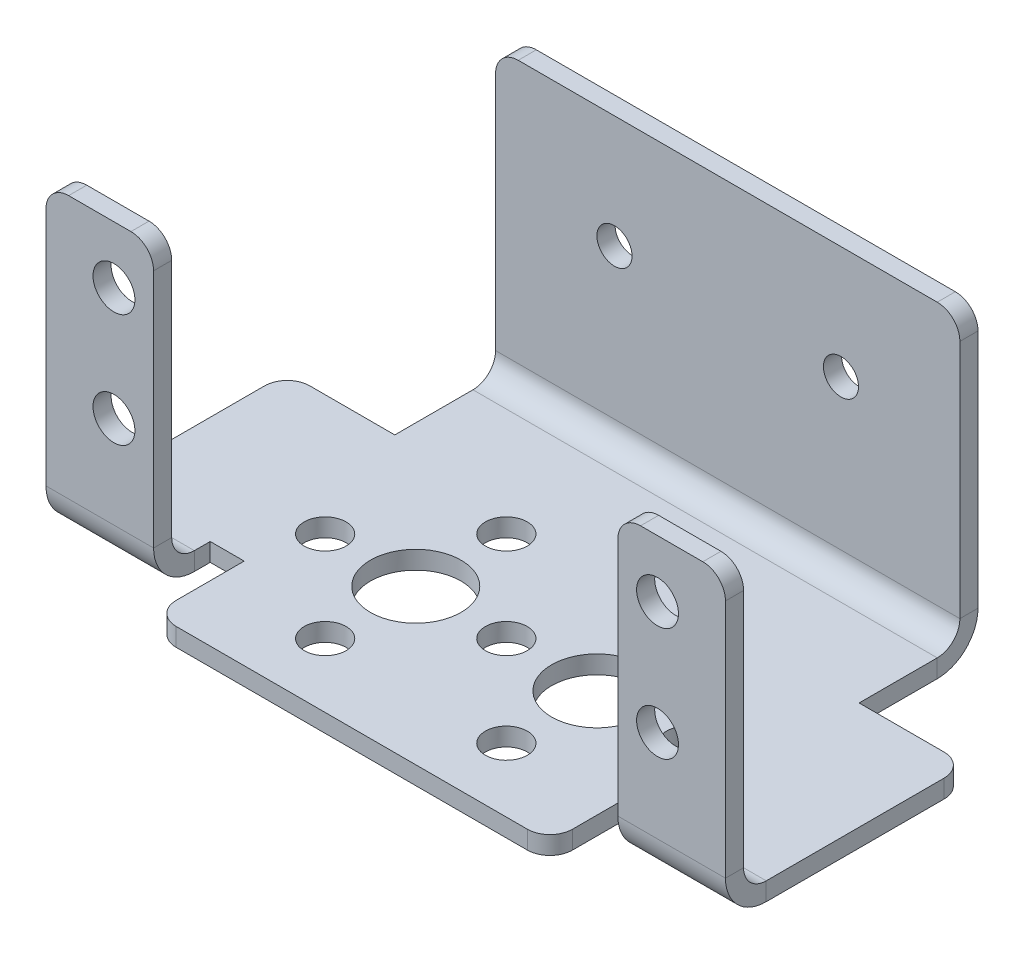
from build123d import *

# Parameters (mm, degrees)
BASE_FLANGE1_DEPTH             = 1.6
EDGE_FLANGE1_STRIP_W           = 10.4
EDGE_FLANGE1_STRIP_H           = 1.6
EDGE_FLANGE1_STRIP_CUT_DEPTH   = 41
EDGE_FLANGE1_STRIP_2_W         = 10.4
EDGE_FLANGE1_STRIP_2_H         = 1.6
EDGE_FLANGE1_STRIP_CUT_2_DEPTH = 9.5
EDGE_FLANGE1_STRIP_3_W         = 10.4
EDGE_FLANGE1_STRIP_3_H         = 1.6
EDGE_FLANGE1_STRIP_CUT_3_DEPTH = 9.5
EDGE_FLANGE1_DEPTH             = 41
EDGE_FLANGE1_BEND_DEPTH        = 9.5
EDGE_FLANGE1_BEND_2_DEPTH      = 9.5
CUT_EXTRUDE1_REACH             = 46.524
SKETCH15_R                     = 1.85
SKETCH15_R_2                   = 4
CUT_EXTRUDE2_REACH             = 53.278
SKETCH16_R                     = 1.85
CUT_EXTRUDE3_REACH             = 54.158
SKETCH17_R                     = 1.55
FILLET1_R                      = 2


# Sheet-metal steps are written as plain solids
with BuildPart() as part:
    # Sketch1 → Base-Flange1 (new body)
    with BuildSketch(Plane(origin=(0, 0, 0), x_dir=(1, 0, 0), z_dir=(0, 1, 0))):
        Polygon((-20.5, 21.15), (20.5, 21.15), (20.5, 10.65), (30, 10.65), (30, -10.65), (20.5, -10.65), (20.5, -5.65), (17.5, -5.65), (17.5, -13.65), (-17.5, -13.65), (-17.5, -5.65), (-20.5, -5.65), (-20.5, -10.65), (-30, -10.65), (-30, 10.65), (-20.5, 10.65), align=None)
    extrude(amount=BASE_FLANGE1_DEPTH)

    # Edge-Flange1 strip (across the edge) → Edge-Flange1 strip cut (cut)
    with BuildSketch(Plane(origin=(20.5, 1.6, -21.15), x_dir=(0, 0, 1), z_dir=(-1, 0, 0))):
        with Locations((-1.6, -0.8)):
            Rectangle(EDGE_FLANGE1_STRIP_W, EDGE_FLANGE1_STRIP_H)
    extrude(amount=EDGE_FLANGE1_STRIP_CUT_DEPTH, mode=Mode.SUBTRACT)

    # Edge-Flange1 strip 2 (across the edge) → Edge-Flange1 strip cut 2 (cut)
    with BuildSketch(Plane(origin=(20.5, 1.6, 10.65), x_dir=(0, 0, -1), z_dir=(1, 0, 0))):
        with Locations((-1.6, -0.8)):
            Rectangle(EDGE_FLANGE1_STRIP_2_W, EDGE_FLANGE1_STRIP_2_H)
    extrude(amount=EDGE_FLANGE1_STRIP_CUT_2_DEPTH, mode=Mode.SUBTRACT)

    # Edge-Flange1 strip 3 (across the edge) → Edge-Flange1 strip cut 3 (cut)
    with BuildSketch(Plane(origin=(-30, 1.6, 10.65), x_dir=(0, 0, -1), z_dir=(1, 0, 0))):
        with Locations((-1.6, -0.8)):
            Rectangle(EDGE_FLANGE1_STRIP_3_W, EDGE_FLANGE1_STRIP_3_H)
    extrude(amount=EDGE_FLANGE1_STRIP_CUT_3_DEPTH, mode=Mode.SUBTRACT)

    # Edge-Flange1 section (across the edge) → Edge-Flange1 (add)
    with BuildSketch(Plane(origin=(20.5, 1.6, -21.15), x_dir=(0, 0, 1), z_dir=(-1, 0, 0))):
        with BuildLine():
            Line((0, 2), (0, 25.2))
            Line((0, 25.2), (1.6, 25.2))
            Line((1.6, 25.2), (1.6, 2))
            ThreePointArc((1.6, 2), (2.185786438, 0.585786438), (3.6, 0))
            Line((3.6, 0), (3.6, -1.6))
            ThreePointArc((3.6, -1.6), (1.054415588, -0.545584412), (0, 2))
        make_face()
    extrude(amount=EDGE_FLANGE1_DEPTH)

    # Edge-Flange1 section 2 (across the edge) → Edge-Flange1 bend (add)
    with BuildSketch(Plane(origin=(20.5, 1.6, 10.65), x_dir=(0, 0, -1), z_dir=(1, 0, 0))):
        with BuildLine():
            Line((0, 2), (0, 25.2))
            Line((0, 25.2), (1.6, 25.2))
            Line((1.6, 25.2), (1.6, 2))
            ThreePointArc((1.6, 2), (2.185786438, 0.585786438), (3.6, 0))
            Line((3.6, 0), (3.6, -1.6))
            ThreePointArc((3.6, -1.6), (1.054415588, -0.545584412), (0, 2))
        make_face()
    extrude(amount=EDGE_FLANGE1_BEND_DEPTH)

    # Edge-Flange1 section 3 (across the edge) → Edge-Flange1 bend 2 (add)
    with BuildSketch(Plane(origin=(-30, 1.6, 10.65), x_dir=(0, 0, -1), z_dir=(1, 0, 0))):
        with BuildLine():
            Line((0, 2), (0, 25.2))
            Line((0, 25.2), (1.6, 25.2))
            Line((1.6, 25.2), (1.6, 2))
            ThreePointArc((1.6, 2), (2.185786438, 0.585786438), (3.6, 0))
            Line((3.6, 0), (3.6, -1.6))
            ThreePointArc((3.6, -1.6), (1.054415588, -0.545584412), (0, 2))
        make_face()
    extrude(amount=EDGE_FLANGE1_BEND_2_DEPTH)

    # Sketch15 → Cut-Extrude1 (cut, up to next)
    with BuildSketch(Plane(origin=(0, 1.6, 0), x_dir=(1, 0, 0), z_dir=(0, 1, 0)), mode=Mode.PRIVATE) as cut_extrude1_sk1:
        with Locations(Location((0, 0, 0), (0, 0, 270))):
            Circle(SKETCH15_R)
    cut_extrude1_tool1 = extrude(cut_extrude1_sk1.sketch, amount=-CUT_EXTRUDE1_REACH, mode=Mode.PRIVATE) & part.part
    # Sketch15 → Cut-Extrude1 (cut, up to next)
    with BuildSketch(Plane(origin=(0, 1.6, 0), x_dir=(1, 0, 0), z_dir=(0, 1, 0)), mode=Mode.PRIVATE) as cut_extrude1_sk2:
        with Locations(Location((8, 0, 0), (0, 0, 270))):
            Circle(SKETCH15_R_2)
    cut_extrude1_tool2 = extrude(cut_extrude1_sk2.sketch, amount=-CUT_EXTRUDE1_REACH, mode=Mode.PRIVATE) & part.part
    # Sketch15 → Cut-Extrude1 (cut, up to next)
    with BuildSketch(Plane(origin=(0, 1.6, 0), x_dir=(1, 0, 0), z_dir=(0, 1, 0)), mode=Mode.PRIVATE) as cut_extrude1_sk3:
        with Locations(Location((-8, 0, 0), (0, 0, 270))):
            Circle(SKETCH15_R_2)
    cut_extrude1_tool3 = extrude(cut_extrude1_sk3.sketch, amount=-CUT_EXTRUDE1_REACH, mode=Mode.PRIVATE) & part.part
    # Sketch15 → Cut-Extrude1 (cut, up to next)
    with BuildSketch(Plane(origin=(0, 1.6, 0), x_dir=(1, 0, 0), z_dir=(0, 1, 0)), mode=Mode.PRIVATE) as cut_extrude1_sk4:
        with Locations(Location((16, 0, 0), (0, 0, 270))):
            Circle(SKETCH15_R)
    cut_extrude1_tool4 = extrude(cut_extrude1_sk4.sketch, amount=-CUT_EXTRUDE1_REACH, mode=Mode.PRIVATE) & part.part
    # Sketch15 → Cut-Extrude1 (cut, up to next)
    with BuildSketch(Plane(origin=(0, 1.6, 0), x_dir=(1, 0, 0), z_dir=(0, 1, 0)), mode=Mode.PRIVATE) as cut_extrude1_sk5:
        with Locations(Location((-16, 0, 0), (0, 0, 270))):
            Circle(SKETCH15_R)
    cut_extrude1_tool5 = extrude(cut_extrude1_sk5.sketch, amount=-CUT_EXTRUDE1_REACH, mode=Mode.PRIVATE) & part.part
    # Sketch15 → Cut-Extrude1 (cut, up to next)
    with BuildSketch(Plane(origin=(0, 1.6, 0), x_dir=(1, 0, 0), z_dir=(0, 1, 0)), mode=Mode.PRIVATE) as cut_extrude1_sk6:
        with Locations(Location((-8, 8, 0), (0, 0, 270))):
            Circle(SKETCH15_R)
    cut_extrude1_tool6 = extrude(cut_extrude1_sk6.sketch, amount=-CUT_EXTRUDE1_REACH, mode=Mode.PRIVATE) & part.part
    # Sketch15 → Cut-Extrude1 (cut, up to next)
    with BuildSketch(Plane(origin=(0, 1.6, 0), x_dir=(1, 0, 0), z_dir=(0, 1, 0)), mode=Mode.PRIVATE) as cut_extrude1_sk7:
        with Locations(Location((-8, -8, 0), (0, 0, 270))):
            Circle(SKETCH15_R)
    cut_extrude1_tool7 = extrude(cut_extrude1_sk7.sketch, amount=-CUT_EXTRUDE1_REACH, mode=Mode.PRIVATE) & part.part
    # Sketch15 → Cut-Extrude1 (cut, up to next)
    with BuildSketch(Plane(origin=(0, 1.6, 0), x_dir=(1, 0, 0), z_dir=(0, 1, 0)), mode=Mode.PRIVATE) as cut_extrude1_sk8:
        with Locations(Location((8, -8, 0), (0, 0, 270))):
            Circle(SKETCH15_R)
    cut_extrude1_tool8 = extrude(cut_extrude1_sk8.sketch, amount=-CUT_EXTRUDE1_REACH, mode=Mode.PRIVATE) & part.part
    # Sketch15 → Cut-Extrude1 (cut, up to next)
    with BuildSketch(Plane(origin=(0, 1.6, 0), x_dir=(1, 0, 0), z_dir=(0, 1, 0)), mode=Mode.PRIVATE) as cut_extrude1_sk9:
        with Locations(Location((8, 8, 0), (0, 0, 270))):
            Circle(SKETCH15_R)
    cut_extrude1_tool9 = extrude(cut_extrude1_sk9.sketch, amount=-CUT_EXTRUDE1_REACH, mode=Mode.PRIVATE) & part.part
    add(cut_extrude1_tool1.solids().sort_by_distance((0, 1.6, 0))[0], mode=Mode.SUBTRACT)
    add(cut_extrude1_tool2.solids().sort_by_distance((8, 1.6, 0))[0], mode=Mode.SUBTRACT)
    add(cut_extrude1_tool3.solids().sort_by_distance((-8, 1.6, 0))[0], mode=Mode.SUBTRACT)
    add(cut_extrude1_tool4.solids().sort_by_distance((16, 1.6, 0))[0], mode=Mode.SUBTRACT)
    add(cut_extrude1_tool5.solids().sort_by_distance((-16, 1.6, 0))[0], mode=Mode.SUBTRACT)
    add(cut_extrude1_tool6.solids().sort_by_distance((-8, 1.6, -8))[0], mode=Mode.SUBTRACT)
    add(cut_extrude1_tool7.solids().sort_by_distance((-8, 1.6, 8))[0], mode=Mode.SUBTRACT)
    add(cut_extrude1_tool8.solids().sort_by_distance((8, 1.6, 8))[0], mode=Mode.SUBTRACT)
    add(cut_extrude1_tool9.solids().sort_by_distance((8, 1.6, -8))[0], mode=Mode.SUBTRACT)

    # Sketch16 → Cut-Extrude2 (cut, up to next)
    with BuildSketch(Plane.XY.offset(10.65), mode=Mode.PRIVATE) as cut_extrude2_sk1:
        with Locations((-24, 21.75)):
            Circle(SKETCH16_R)
    cut_extrude2_tool1 = extrude(cut_extrude2_sk1.sketch, amount=-CUT_EXTRUDE2_REACH, mode=Mode.PRIVATE) & part.part
    # Sketch16 → Cut-Extrude2 (cut, up to next)
    with BuildSketch(Plane.XY.offset(10.65), mode=Mode.PRIVATE) as cut_extrude2_sk2:
        with Locations((-24, 11.75)):
            Circle(SKETCH16_R)
    cut_extrude2_tool2 = extrude(cut_extrude2_sk2.sketch, amount=-CUT_EXTRUDE2_REACH, mode=Mode.PRIVATE) & part.part
    # Sketch16 → Cut-Extrude2 (cut, up to next)
    with BuildSketch(Plane.XY.offset(10.65), mode=Mode.PRIVATE) as cut_extrude2_sk3:
        with Locations((24, 21.75)):
            Circle(SKETCH16_R)
    cut_extrude2_tool3 = extrude(cut_extrude2_sk3.sketch, amount=-CUT_EXTRUDE2_REACH, mode=Mode.PRIVATE) & part.part
    # Sketch16 → Cut-Extrude2 (cut, up to next)
    with BuildSketch(Plane.XY.offset(10.65), mode=Mode.PRIVATE) as cut_extrude2_sk4:
        with Locations((24, 11.75)):
            Circle(SKETCH16_R)
    cut_extrude2_tool4 = extrude(cut_extrude2_sk4.sketch, amount=-CUT_EXTRUDE2_REACH, mode=Mode.PRIVATE) & part.part
    add(cut_extrude2_tool1.solids().sort_by_distance((-24, 21.75, 10.65))[0], mode=Mode.SUBTRACT)
    add(cut_extrude2_tool2.solids().sort_by_distance((-24, 11.75, 10.65))[0], mode=Mode.SUBTRACT)
    add(cut_extrude2_tool3.solids().sort_by_distance((24, 21.75, 10.65))[0], mode=Mode.SUBTRACT)
    add(cut_extrude2_tool4.solids().sort_by_distance((24, 11.75, 10.65))[0], mode=Mode.SUBTRACT)

    # Sketch17 → Cut-Extrude3 (cut, up to next)
    with BuildSketch(Plane.XY.offset(-19.55), mode=Mode.PRIVATE) as cut_extrude3_sk1:
        with Locations((-10, 16.85)):
            Circle(SKETCH17_R)
    cut_extrude3_tool1 = extrude(cut_extrude3_sk1.sketch, amount=-CUT_EXTRUDE3_REACH, mode=Mode.PRIVATE) & part.part
    # Sketch17 → Cut-Extrude3 (cut, up to next)
    with BuildSketch(Plane.XY.offset(-19.55), mode=Mode.PRIVATE) as cut_extrude3_sk2:
        with Locations((10, 16.85)):
            Circle(SKETCH17_R)
    cut_extrude3_tool2 = extrude(cut_extrude3_sk2.sketch, amount=-CUT_EXTRUDE3_REACH, mode=Mode.PRIVATE) & part.part
    add(cut_extrude3_tool1.solids().sort_by_distance((-10, 16.85, -19.55))[0], mode=Mode.SUBTRACT)
    add(cut_extrude3_tool2.solids().sort_by_distance((10, 16.85, -19.55))[0], mode=Mode.SUBTRACT)

    # Fillet1
    fillet1_edges = [part.edges().sort_by_distance(p)[0] for p in [
        (20.5, 26.8, 9.85),
        (30, 26.8, 9.85),
        (-30, 26.8, 9.85),
        (-20.5, 26.8, 9.85),
        (30, 0.8, -10.65),
        (17.5, 0.8, 13.65),
        (-17.5, 0.8, 13.65),
        (-30, 0.8, -10.65),
        (20.5, 26.8, -20.35),
        (-20.5, 26.8, -20.35),
    ]]
    fillet(fillet1_edges, radius=FILLET1_R)


solid = part.part
